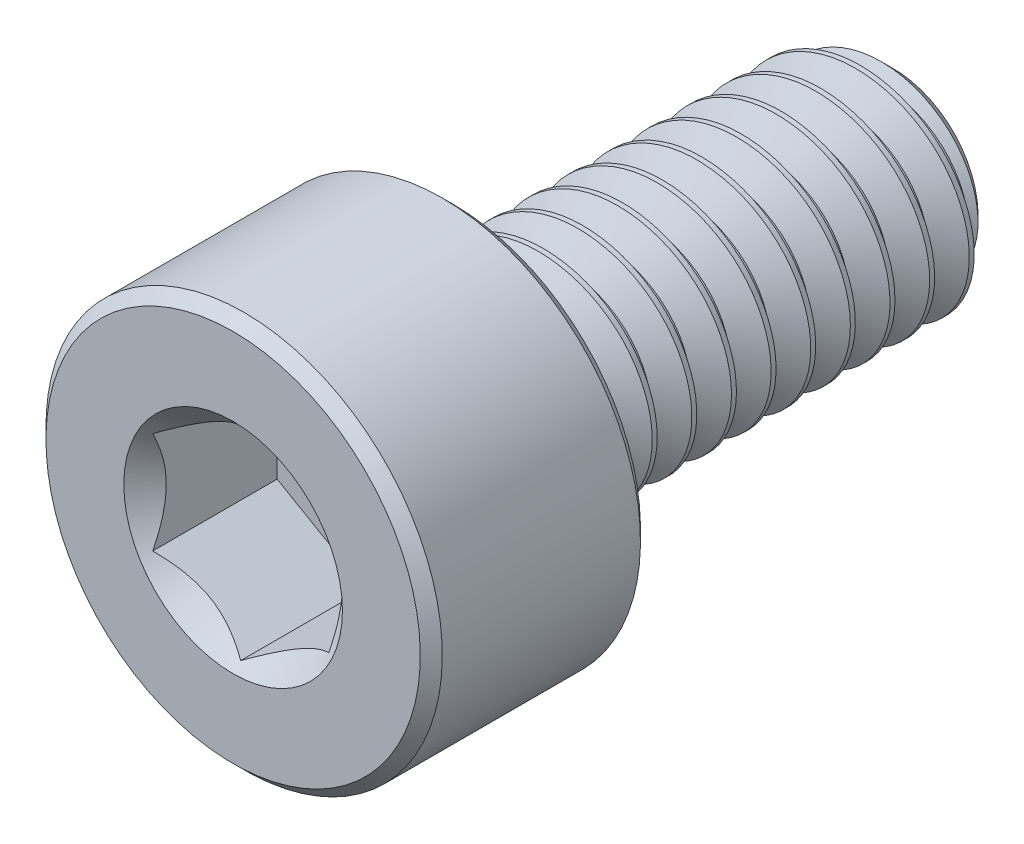
from build123d import *

# Parameters (mm, degrees)
CUT_EXTRUDE1_DEPTH     = 1.5
SPLIT1_SURFACE_1_BACK  = 10.836
SPLIT1_SURFACE_1_DEPTH = 21.672
SPLIT1_SURFACE_2_BACK  = 10.836
SPLIT1_SURFACE_2_DEPTH = 21.672
CUT_SWEEP1_PITCH       = 0.45


with BuildPart() as part:
    # Sketch2 → Revolve1 (revolve)
    with BuildSketch(Plane(origin=(0, 0, 0), x_dir=(0, 0, -1), z_dir=(1, 0, 0))):
        with BuildLine():
            Line((-3.75, 0), (-3.75, 2.125))
            Line((-3.75, 2.125), (-3.625, 2.25))
            Line((-3.625, 2.25), (-1.375, 2.25))
            Line((-1.375, 2.25), (-1.25, 2.125))
            Line((-1.25, 2.125), (-1.25, 1.375))
            ThreePointArc((-1.25, 1.375), (-1.213388348, 1.286611652), (-1.125, 1.25))
            Line((-1.125, 1.25), (3.457716426, 1.25))
            Line((3.457716426, 1.25), (3.75, 0.957716426))
            Line((3.75, 0.957716426), (3.75, 0))
            Line((3.75, 0), (-3.75, 0))
        make_face()
    revolve(axis=Axis((0, 0, -3.75), (0, 0, 1)))

    # Sketch3 → Cut-Extrude1 (cut)
    with BuildSketch(Plane.XY.offset(3.75)):
        Polygon((1, -0.577350269), (1, 0.577350269), (0, 1.154700538), (-1, 0.577350269), (-1, -0.577350269), (0, -1.154700538), align=None)
    extrude(amount=-CUT_EXTRUDE1_DEPTH, mode=Mode.SUBTRACT)

    # Cut-Extrude2 cone 1 section (through the dimple's axis) → Cut-Extrude2 (revolve, cut)
    with BuildSketch(Plane(origin=(0, 0, 3.75), x_dir=(0, -1, 0), z_dir=(1, 0, 0))):
        Polygon((0, 0), (1.241303079, 0), (0, 1.241303079), align=None)
    revolve(axis=Axis((0, 0, 3.75), (0, 0, -1)), mode=Mode.SUBTRACT)


with BuildPart() as body_2:
    # Split1: the piece behind the surface
    add(part.part)
    # Split1 surface: a surface, the sketch's curves swept straight by 21.672 mm
    with BuildLine(Plane(origin=(0, 0, 0), x_dir=(0, 0, -1), z_dir=(1, 0, 0)).offset(-SPLIT1_SURFACE_1_BACK), mode=Mode.PRIVATE) as split1_surface_1_path:
        Line((-1.125, -2.25), (-1.125, 2.25))
    split1_surface_1 = Shell.extrude(split1_surface_1_path.wire(), (1 * SPLIT1_SURFACE_1_DEPTH, 0 * SPLIT1_SURFACE_1_DEPTH, 0 * SPLIT1_SURFACE_1_DEPTH))
    split(bisect_by=split1_surface_1, keep=Keep.BOTTOM)

    # Cut-Sweep1: the profile of Sketch7 screwed along a right-hand helix of 12.111111 turns, 6 arcs to a turn; built about Z, then put on its axis
    cut_sweep1_z = Axis((0, 0, 0), (0, 0, 1))
    cut_sweep1_corners = [(1.274356964, 0, 0.0140625), (1.274356964, 0, -0.4078125), (0.957716426, 0, -0.225), (0.957716426, 0, -0.16875)]
    with BuildLine(mode=Mode.PRIVATE) as cut_sweep1_profile:
        Line(cut_sweep1_corners[0], cut_sweep1_corners[1])
        Line(cut_sweep1_corners[1], cut_sweep1_corners[2])
        Line(cut_sweep1_corners[2], cut_sweep1_corners[3])
        Line(cut_sweep1_corners[3], cut_sweep1_corners[0])
    cut_sweep1_cap = Face(cut_sweep1_profile.wire())
    cut_sweep1_turn_angles = [0, 30, 60, 90, 120, 150, 180, 210, 240, 270, 300, 330, 360]
    cut_sweep1_turn_weights = [1, 0.8660254037844387, 1, 0.8660254037844387, 1, 0.8660254037844387, 1, 0.8660254037844387, 1, 0.8660254037844387, 1, 0.8660254037844387, 1]
    cut_sweep1_turn_rails = [Edge.make_bspline([Vector(p[0], p[1], 0).rotate(cut_sweep1_z, cut_sweep1_turn_angles[k]) / cut_sweep1_turn_weights[k] + Vector(0, 0, p[2] + CUT_SWEEP1_PITCH * cut_sweep1_turn_angles[k] / 360) for k in range(13)], [0, 0, 0, 1, 1, 2, 2, 3, 3, 4, 4, 5, 5, 6, 6, 6], 2, cut_sweep1_turn_weights) for p in cut_sweep1_corners]
    cut_sweep1_turn_sides = [Face.make_surface_from_curves(cut_sweep1_turn_rails[p[0]], cut_sweep1_turn_rails[p[1]]) for p in [(0, 1), (1, 2), (2, 3), (3, 0)]]
    cut_sweep1_last_angles = [4320, 4340, 4360]
    cut_sweep1_last_weights = [1, 0.9396926207859084, 1]
    cut_sweep1_last_rails = [Edge.make_bspline([Vector(p[0], p[1], 0).rotate(cut_sweep1_z, cut_sweep1_last_angles[k]) / cut_sweep1_last_weights[k] + Vector(0, 0, p[2] + CUT_SWEEP1_PITCH * cut_sweep1_last_angles[k] / 360) for k in range(3)], [0, 0, 0, 1, 1, 1], 2, cut_sweep1_last_weights) for p in cut_sweep1_corners]
    cut_sweep1_last_sides = [Face.make_surface_from_curves(cut_sweep1_last_rails[p[0]], cut_sweep1_last_rails[p[1]]) for p in [(0, 1), (1, 2), (2, 3), (3, 0)]]
    cut_sweep1 = Plane(origin=(0, 0, -3.75), x_dir=(0, 1, 0), z_dir=(0, 0, 1)) * Solid(Shell([*[p.moved(Location((0, 0, CUT_SWEEP1_PITCH * i))) for i in range(12) for p in cut_sweep1_turn_sides], *cut_sweep1_last_sides, cut_sweep1_cap, cut_sweep1_cap.rotate(cut_sweep1_z, 4360).moved(Location((0, 0, CUT_SWEEP1_PITCH * 4360 / 360)))]))
    add(cut_sweep1, mode=Mode.SUBTRACT)


with BuildPart() as part_1:
    add(part.part)

    # Split1: split by a surface, the side it looks to stays
    # Split1 surface: a surface, the sketch's curves swept straight by 21.672 mm
    with BuildLine(Plane(origin=(0, 0, 0), x_dir=(0, 0, -1), z_dir=(1, 0, 0)).offset(-SPLIT1_SURFACE_2_BACK), mode=Mode.PRIVATE) as split1_surface_2_path:
        Line((-1.125, -2.25), (-1.125, 2.25))
    split1_surface_2 = Shell.extrude(split1_surface_2_path.wire(), (1 * SPLIT1_SURFACE_2_DEPTH, 0 * SPLIT1_SURFACE_2_DEPTH, 0 * SPLIT1_SURFACE_2_DEPTH))
    split(bisect_by=split1_surface_2, keep=Keep.TOP)

    add(body_2.part)  # Revolve2 merges body 2
    # Sketch8 → Revolve2 (revolve)
    with BuildSketch(Plane(origin=(0, 0, 0), x_dir=(0, 0, -1), z_dir=(1, 0, 0)), mode=Mode.PRIVATE) as revolve2_sk:
        Polygon((-1.25, 0), (-1.25, 1.25), (-1.125, 1.25), (-0.403312164, 0), align=None)
    revolve(revolve2_sk.sketch.rotate(Axis((0, 0, 0.403312164), (0, 0, 1)), 270), axis=Axis((0, 0, 0.403312164), (0, 0, 1)))


solid = part_1.part
